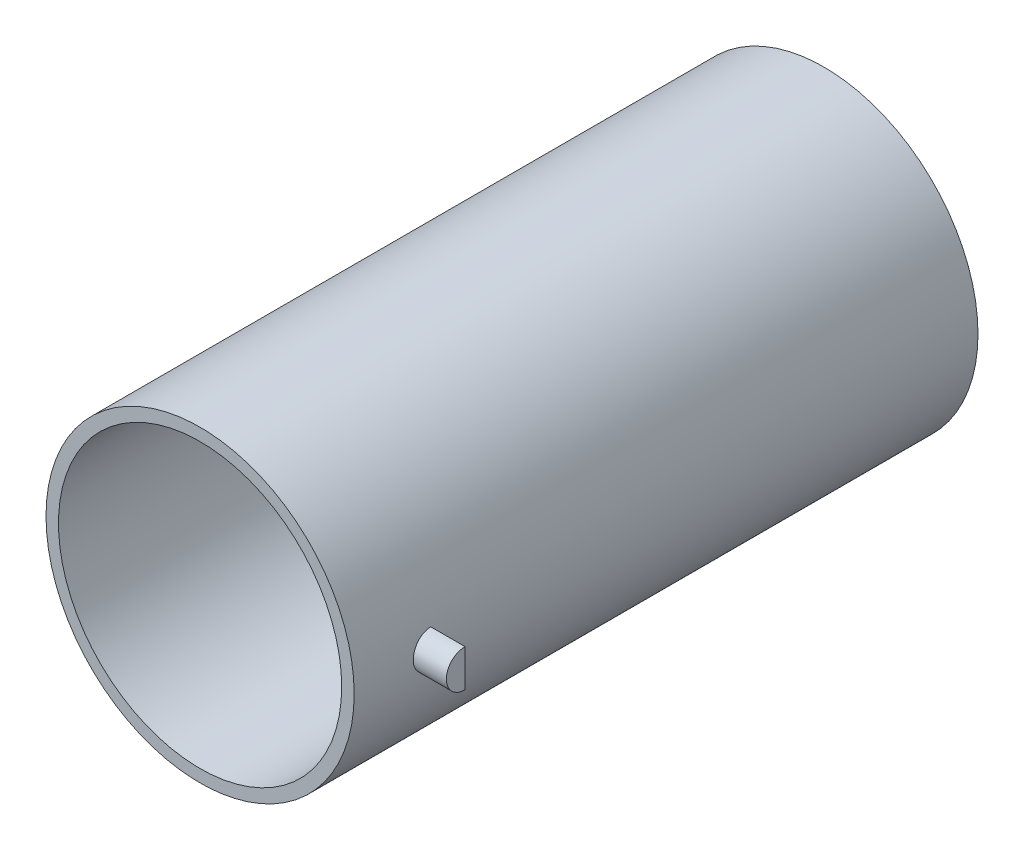
from build123d import *

# Parameters (mm, degrees)
SKETCH1_R                = 31.369
BOSS_EXTRUDE1_DEPTH      = 127
BOSS_EXTRUDE2_DEPTH      = 38.1
BOSS_EXTRUDE2_DEPTH_BACK = 38.1
SHELL3_START             = 2.54
SHELL3_OUTLINE_R         = 28.829
SHELL3_DEPTH             = 124.46


# Read off the part's stored shape, not the designer's step: Shell3
with BuildPart() as part:
    # Sketch1 → Boss-Extrude1 (new body)
    with BuildSketch(Plane.XY):
        Circle(SKETCH1_R)
    extrude(amount=BOSS_EXTRUDE1_DEPTH)

    # Sketch2 → Boss-Extrude2 (add, two sides: drawn at the far end of the back side and taken through both)
    with BuildSketch(Plane(origin=(0, 0, 0), x_dir=(0, 0, -1), z_dir=(1, 0, 0)).offset(-BOSS_EXTRUDE2_DEPTH_BACK)):
        with BuildLine():
            Line((-111.161571782, 3.81), (-111.161571782, -3.81))
            ThreePointArc((-111.161571782, -3.81), (-114.971571782, 0), (-111.161571782, 3.81))
        make_face()
    extrude(amount=BOSS_EXTRUDE2_DEPTH + BOSS_EXTRUDE2_DEPTH_BACK)

    # Shell3 outline → Shell3 (cut)
    with BuildSketch(Plane.XY.offset(SHELL3_START)):
        Circle(SHELL3_OUTLINE_R)
    extrude(amount=SHELL3_DEPTH, mode=Mode.SUBTRACT)


solid = part.part
